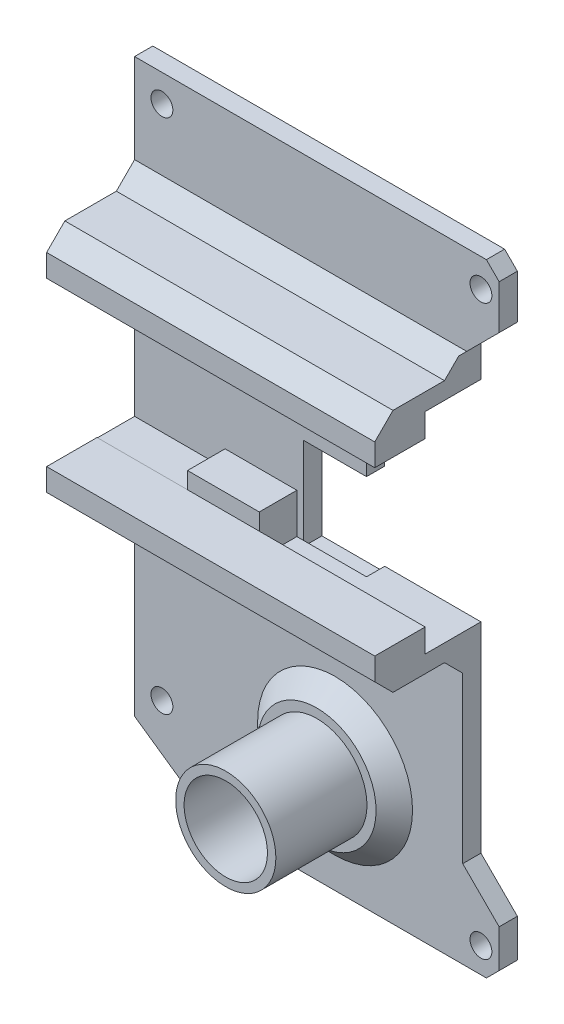
from build123d import *

# Parameters (mm, degrees)
SKETCH_1_R          = 4.575
SKETCH_1_W          = 6.9
SKETCH_1_H          = 10.08
SKETCH_1_R_2        = 1.2
EXTRUDE_1_DEPTH     = 2
EXTRUDE_2_DEPTH     = 4.125036756
SKETCH_3_W          = 1.88
SKETCH_3_H          = 14.24
CUT_EXTRUDE_1_DEPTH = 4.125036756
SKETCH_4_W          = 6.9
SKETCH_4_H          = 0.56
SKETCH_4_H_2        = 0.55
EXTRUDE_3_DEPTH     = 4.125036756
SKETCH_5_W          = 0.215
SKETCH_5_H          = 23.05
CUT_EXTRUDE_2_DEPTH = 4.125036756
SKETCH_6_W          = 0.745
SKETCH_6_H          = 2.575
SKETCH_6_W_2        = 6.9
EXTRUDE_4_DEPTH     = 2
SKETCH_7_R          = 5.5
SKETCH_7_R_2        = 4.575
EXTRUDE_5_DEPTH     = 12
CHAMFER_1_SIZE      = 0.6
SKETCH_8_R          = 6.5
SKETCH_8_R_2        = 5.5
EXTRUDE_6_DEPTH     = 2
EXTRUDE_7_DEPTH     = 15.935
SKETCH_10_W         = 36.02
SKETCH_10_H         = 4.455
EXTRUDE_8_DEPTH     = 3.53
CHAMFER_3_SIZE      = 2
CHAMFER_4_SIZE      = 2
CUT_EXTRUDE_4_DEPTH = 10


with BuildPart() as part:
    # 草图1 → 凸台-拉伸1 (new body)
    # profile 1 of 2: a face of its own
    with BuildSketch(Plane.XY):
        Polygon((83.862310964, 7.15), (85.802310964, 7.15), (85.802310964, 13.83), (83.862310964, 13.83), (83.862310964, 25.12), (77.212310964, 25.12), (77.212310964, 30), (66.372310964, 30), (66.372310964, 25.12), (59.662310964, 25.12), (59.662310964, 25.076338502), (59.782310964, 25), (59.782310964, -34.93), (83.862310964, -34.93), align=None)
        with Locations((71.792310964, -25.065)):
            Circle(SKETCH_1_R, mode=Mode.SUBTRACT)
        with Locations((71.792310964, -0.89)):
            Rectangle(SKETCH_1_W, SKETCH_1_H, mode=Mode.SUBTRACT)
        with Locations((71.792310964, 13.19)):
            Rectangle(SKETCH_1_W, SKETCH_1_H, mode=Mode.SUBTRACT)
    # profile 2 of 2: a face of its own
    with BuildSketch(Plane.XY):
        Polygon((85.802310964, -27.361541817), (85.802310964, 7.15), (83.862310964, 7.15), (83.862310964, -34.93), (59.782310964, -34.93), (59.782310964, 25), (59.662310964, 25.076338502), (59.662310964, 25.12), (66.372310964, 25.12), (66.372310964, 30), (77.212310964, 30), (77.212310964, 25.12), (83.862310964, 25.12), (83.862310964, 13.83), (85.802310964, 13.83), (85.802310964, 21.12), (89.802310964, 25.12), (89.802310964, 29.961541817), (88.402310964, 31.361541817), (49.782310964, 31.361541817), (49.782310964, -31.361541817), (57.782310964, -36.93), (88.402310964, -36.93), (89.802310964, -35.53), (89.802310964, -31.361541817), align=None)
        with Locations((52.782310964, -28.361541817)):
            Circle(SKETCH_1_R_2, mode=Mode.SUBTRACT)
        with Locations((87.802310964, -34.145770908)):
            Circle(SKETCH_1_R_2, mode=Mode.SUBTRACT)
        with Locations((52.782310964, 28.361541817)):
            Circle(SKETCH_1_R_2, mode=Mode.SUBTRACT)
        with Locations((87.802310964, 28.240770908)):
            Circle(SKETCH_1_R_2, mode=Mode.SUBTRACT)
    extrude(amount=EXTRUDE_1_DEPTH)

    # 草图2 → 凸台-拉伸2 (add)
    with BuildSketch(Plane.XY.offset(2)):
        Polygon((79.187310964, 17.68), (79.187310964, 19.56), (65.717310964, 19.56), (65.717310964, 15.155), (59.717310964, 15.155), (59.717310964, -2.845), (65.717310964, -2.845), (65.717310964, -7.25), (79.187310964, -7.25), (79.187310964, -5.37), (75.242310964, -5.37), (75.242310964, -5.93), (68.342310964, -5.93), (68.342310964, -5.37), (67.597310964, -5.37), (67.597310964, -0.965), (61.597310964, -0.965), (61.597310964, 13.275), (67.597310964, 13.275), (67.597310964, 17.68), (68.342310964, 17.68), (68.342310964, 18.23), (75.242310964, 18.23), (75.242310964, 17.68), align=None)
        Polygon((83.187310964, 17.68), (83.187310964, 19.56), (79.187310964, 19.56), (79.187310964, 17.68), (81.067310964, 17.68), (81.307310964, 17.68), align=None)
        Polygon((85.802310964, 19.56), (83.187310964, 19.56), (83.187310964, 17.68), (85.587310964, 17.68), (85.587310964, -5.37), (83.187310964, -5.37), (83.187310964, -7.25), (85.802310964, -7.25), align=None)
        Polygon((79.187310964, -7.25), (83.187310964, -7.25), (83.187310964, -5.37), (81.307310964, -5.37), (81.067310964, -5.37), (79.187310964, -5.37), align=None)
    extrude(amount=EXTRUDE_2_DEPTH)

    # 草图3 → 切除-拉伸1 (cut)
    with BuildSketch(Plane.XY.offset(6.125036756)):
        with Locations((60.657310964, 6.155)):
            Rectangle(SKETCH_3_W, SKETCH_3_H)
    extrude(amount=-CUT_EXTRUDE_1_DEPTH, mode=Mode.SUBTRACT)

    # 草图4 → 凸台-拉伸3 (add)
    with BuildSketch(Plane.XY.offset(6.125036756)):
        with Locations((71.792310964, -5.65)):
            Rectangle(SKETCH_4_W, SKETCH_4_H)
        with Locations((71.792310964, 17.955)):
            Rectangle(SKETCH_4_W, SKETCH_4_H_2)
    extrude(amount=-EXTRUDE_3_DEPTH)

    # 草图5 → 切除-拉伸2 (cut)
    with BuildSketch(Plane.XY.offset(6.125036756)):
        with Locations((85.694810964, 6.155)):
            Rectangle(SKETCH_5_W, SKETCH_5_H)
    extrude(amount=-CUT_EXTRUDE_2_DEPTH, mode=Mode.SUBTRACT)

    # 草图6 → 凸台-拉伸4 (add)
    with BuildSketch(Plane.XY.offset(6.125036756)):
        Polygon((67.597310964, -5.37), (67.597310964, -2.795), (65.717310964, -2.795), (65.717310964, -2.845), (65.717310964, -7.25), (67.597310964, -7.25), align=None)
        Polygon((85.802310964, -5.37), (75.242310964, -5.37), (68.342310964, -5.37), (67.597310964, -5.37), (67.597310964, -7.25), (85.802310964, -7.25), align=None)
        with Locations((67.969810964, -4.0825)):
            Rectangle(SKETCH_6_W, SKETCH_6_H)
        with Locations((71.792310964, -4.0825)):
            Rectangle(SKETCH_6_W_2, SKETCH_6_H)
        Polygon((85.467310964, -2.795), (81.187310964, -2.795), (75.242310964, -2.795), (75.242310964, -5.37), (85.802310964, -5.37), (85.802310964, -2.795), align=None)
        Polygon((65.717310964, 15.105), (67.597310964, 15.105), (67.597310964, 17.68), (67.597310964, 19.56), (65.717310964, 19.56), (65.717310964, 15.155), align=None)
        Polygon((68.342310964, 17.68), (75.242310964, 17.68), (85.802310964, 17.68), (85.802310964, 19.56), (67.597310964, 19.56), (67.597310964, 17.68), align=None)
        with Locations((67.969810964, 16.3925)):
            Rectangle(SKETCH_6_W, SKETCH_6_H)
        with Locations((71.792310964, 16.3925)):
            Rectangle(SKETCH_6_W_2, SKETCH_6_H)
        Polygon((75.242310964, 15.105), (81.187310964, 15.105), (85.467310964, 15.105), (85.802310964, 15.105), (85.802310964, 17.68), (75.242310964, 17.68), align=None)
    extrude(amount=EXTRUDE_4_DEPTH)

    # 草图7 → 凸台-拉伸5 (add)
    with BuildSketch(Plane.XY.offset(2)):
        with Locations((71.792310964, -25.065)):
            Circle(SKETCH_7_R)
        with Locations((71.792310964, -25.065)):
            Circle(SKETCH_7_R_2, mode=Mode.SUBTRACT)
    extrude(amount=EXTRUDE_5_DEPTH)

    # 倒角1
    chamfer_1_edges = [part.edges().sort_by_distance(p)[0] for p in [
        (67.217310964, -25.065, 0),
    ]]
    chamfer(chamfer_1_edges, length=CHAMFER_1_SIZE)

    # 草图8 → 凸台-拉伸6 (add)
    with BuildSketch(Plane.XY.offset(2)):
        with Locations((71.792310964, -25.065)):
            Circle(SKETCH_8_R)
        with Locations((71.792310964, -25.065)):
            Circle(SKETCH_8_R_2, mode=Mode.SUBTRACT)
    extrude(amount=EXTRUDE_6_DEPTH)

    # 草图9 → 凸台-拉伸7 (add)
    with BuildSketch(Plane.ZY.offset(-65.717310964)):
        Polygon((2, -7.25), (8.125036756, -7.25), (8.125036756, -2.795), (6.125036756, -2.795), (6.125036756, -2.845), (2, -2.845), align=None)
        Polygon((2, 15.155), (6.125036756, 15.155), (6.125036756, 15.105), (8.125036756, 15.105), (8.125036756, 19.56), (2, 19.56), align=None)
    extrude(amount=EXTRUDE_7_DEPTH)

    # 草图10 → 凸台-拉伸8 (add)
    with BuildSketch(Plane.XY.offset(8.125036756)):
        with Locations((67.792310964, -5.0225)):
            Rectangle(SKETCH_10_W, SKETCH_10_H)
        with Locations((67.792310964, 17.3325)):
            Rectangle(SKETCH_10_W, SKETCH_10_H)
    extrude(amount=EXTRUDE_8_DEPTH)

    # 倒角3
    chamfer_3_edges = [part.edges().sort_by_distance(p)[0] for p in [
        (67.792310964, 19.56, 11.655036756),
        (67.792310964, -7.25, 11.655036756),
        (67.792310964, 19.56, 2),
        (67.792310964, -7.25, 2),
    ]]
    chamfer(chamfer_3_edges, length=CHAMFER_3_SIZE)

    # 倒角4
    chamfer_4_edges = [part.edges().sort_by_distance(p)[0] for p in [
        (65.292310964, -25.065, 2),
    ]]
    chamfer(chamfer_4_edges, length=CHAMFER_4_SIZE - 0.0001)  # a hair under: the kernel refuses the full size

    # 草图12 → 切除-拉伸4 (cut)
    with BuildSketch(Plane.XY.offset(2)):
        Polygon((75.242310964, 8.15), (75.242310964, 4.15), (75.242310964, -5.37), (85.802310964, -5.37), (85.802310964, 17.68), (75.242310964, 17.68), align=None)
    extrude(amount=-CUT_EXTRUDE_4_DEPTH, mode=Mode.SUBTRACT)


solid = part.part
